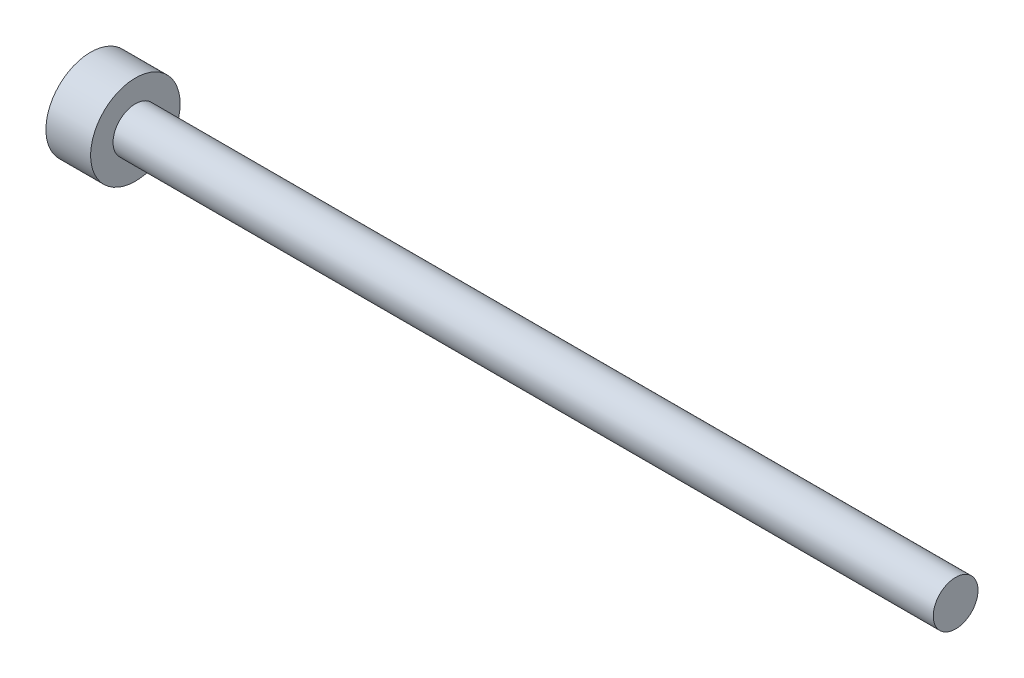
from build123d import *

# Parameters (mm, degrees)
SKETCH1_R           = 3
BOSS_EXTRUDE1_DEPTH = 3
SKETCH2_R           = 1.5
BOSS_EXTRUDE2_DEPTH = 55


with BuildPart() as part:
    # Sketch1 → Boss-Extrude1 (new body)
    with BuildSketch(Plane(origin=(0, 0, 0), x_dir=(0, 0, -1), z_dir=(1, 0, 0))):
        Circle(SKETCH1_R)
    extrude(amount=BOSS_EXTRUDE1_DEPTH)

    # Sketch2 → Boss-Extrude2 (add)
    with BuildSketch(Plane(origin=(3, 0, 0), x_dir=(0, 0, -1), z_dir=(1, 0, 0))):
        Circle(SKETCH2_R)
    extrude(amount=BOSS_EXTRUDE2_DEPTH)


solid = part.part
